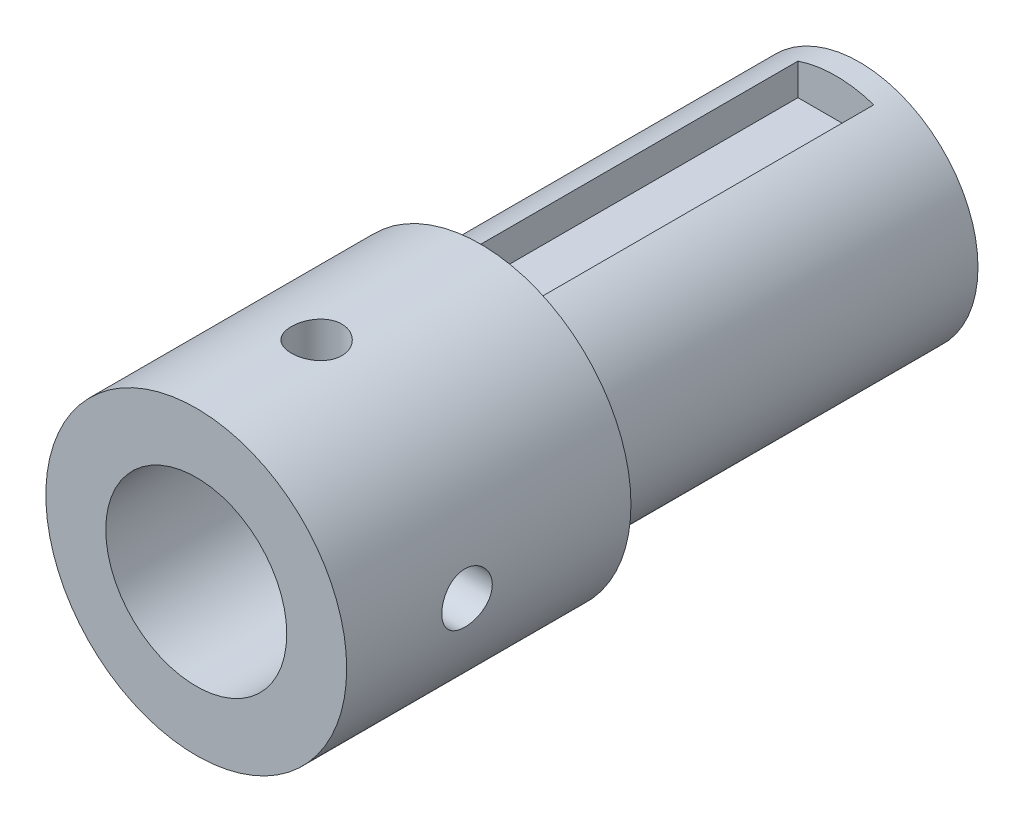
from build123d import *

# Parameters (mm, degrees)
SKETCH1_R           = 12.5
BOSS_EXTRUDE1_DEPTH = 40
SKETCH2_W           = 8
SKETCH2_H           = 35
CUT_EXTRUDE1_DEPTH  = 4
SKETCH3_R           = 15.875
BOSS_EXTRUDE2_DEPTH = 30
SKETCH5_R           = 9.5504
CUT_EXTRUDE2_DEPTH  = 25.4
CUT_EXTRUDE3_REACH  = 75.512
SKETCH6_R           = 2.665
CIRPATTERN1_COUNT   = 2
CIRPATTERN1_ANGLE   = 90


with BuildPart() as part:
    # Sketch1 → Boss-Extrude1 (new body)
    with BuildSketch(Plane.XY):
        Circle(SKETCH1_R)
    extrude(amount=BOSS_EXTRUDE1_DEPTH)

    # Sketch2 → Cut-Extrude1 (cut)
    with BuildSketch(Plane(origin=(0, 12.5, 0), x_dir=(1, 0, 0), z_dir=(0, 1, 0))):
        with Locations((0, -20)):
            Rectangle(SKETCH2_W, SKETCH2_H)
    extrude(amount=-CUT_EXTRUDE1_DEPTH, mode=Mode.SUBTRACT)

    # Sketch3 → Boss-Extrude2 (add)
    with BuildSketch(Plane.XY.offset(40)):
        Circle(SKETCH3_R)
    extrude(amount=BOSS_EXTRUDE2_DEPTH)

    # Sketch5 → Cut-Extrude2 (cut)
    with BuildSketch(Plane.XY.offset(70)):
        Circle(SKETCH5_R)
    extrude(amount=-CUT_EXTRUDE2_DEPTH, mode=Mode.SUBTRACT)

    # Sketch6 → Cut-Extrude3 (cut, up to next)
    with BuildSketch(Plane(origin=(0, 0, 0), x_dir=(1, 0, 0), z_dir=(0, 1, 0)), mode=Mode.PRIVATE) as cut_extrude3_sk1:
        with Locations((0, -57.3)):
            Circle(SKETCH6_R)
    cut_extrude3_tool1 = extrude(cut_extrude3_sk1.sketch, amount=CUT_EXTRUDE3_REACH, mode=Mode.PRIVATE) & part.part
    cut_extrude3 = cut_extrude3_tool1.solids().sort_by_distance((0, 0, 57.3))[0]
    add(cut_extrude3, mode=Mode.SUBTRACT)

    # CirPattern1: Cut-Extrude3 ×2 about axis
    cirpattern1_axis = Axis((0, 0, 70), (0, 0, -1))
    for i in range(1, CIRPATTERN1_COUNT):
        add(cut_extrude3.rotate(cirpattern1_axis, i * CIRPATTERN1_ANGLE / (CIRPATTERN1_COUNT - 1)), mode=Mode.SUBTRACT)


solid = part.part
